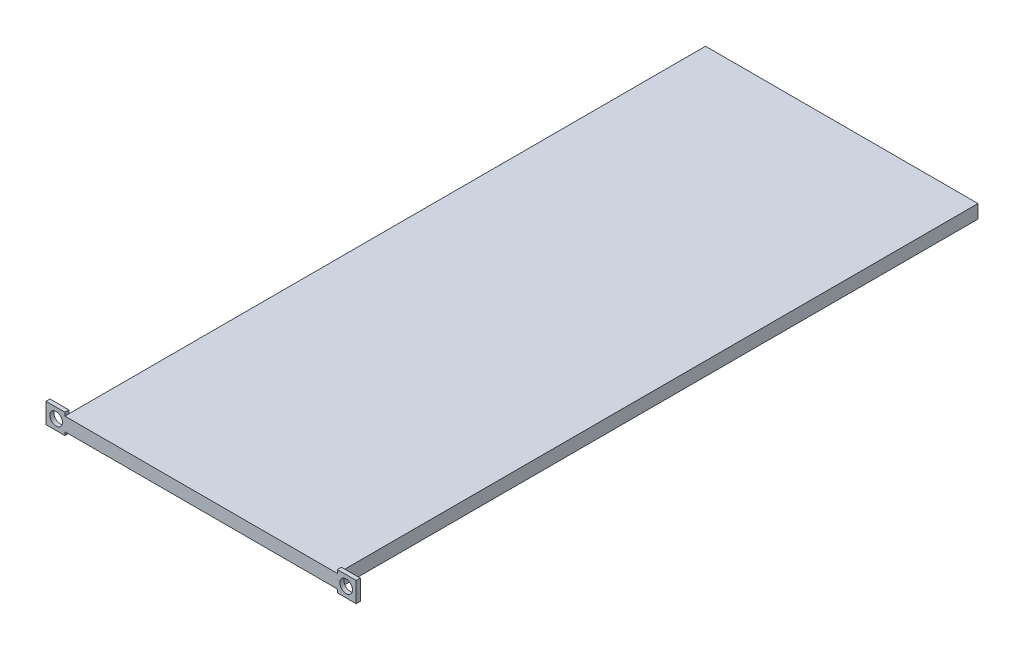
from build123d import *

# Parameters (mm, degrees)
SKETCH1_W           = 202
SKETCH1_H           = 10
BOSS_EXTRUDE1_DEPTH = 475
SKETCH2_W           = 3
SKETCH2_H           = 15
BOSS_EXTRUDE2_DEPTH = 14
SKETCH4_W           = 3
SKETCH4_H           = 15
BOSS_EXTRUDE3_DEPTH = 14
SKETCH3_R           = 4.7
CUT_EXTRUDE1_DEPTH  = 13


with BuildPart() as part:
    # Sketch1 → Boss-Extrude1 (new body)
    with BuildSketch(Plane.XY):
        with Locations((101, 5)):
            Rectangle(SKETCH1_W, SKETCH1_H)
    extrude(amount=BOSS_EXTRUDE1_DEPTH)

    # Sketch2 → Boss-Extrude2 (add)
    with BuildSketch(Plane.ZY):
        with Locations((473.5, 5)):
            Rectangle(SKETCH2_W, SKETCH2_H)
    extrude(amount=BOSS_EXTRUDE2_DEPTH)

    # Sketch4 → Boss-Extrude3 (add)
    with BuildSketch(Plane(origin=(202, 0, 0), x_dir=(0, 0, -1), z_dir=(1, 0, 0))):
        with Locations((-473.5, 5)):
            Rectangle(SKETCH4_W, SKETCH4_H)
    extrude(amount=BOSS_EXTRUDE3_DEPTH)

    # Sketch3 → Cut-Extrude1 (cut)
    with BuildSketch(Plane(origin=(0, 0, 472), x_dir=(-1, 0, 0), z_dir=(0, 0, -1))):
        with Locations((6.5, 5)):
            Circle(SKETCH3_R)
        with Locations((-208.5, 5)):
            Circle(SKETCH3_R)
    extrude(amount=-CUT_EXTRUDE1_DEPTH, mode=Mode.SUBTRACT)


solid = part.part
